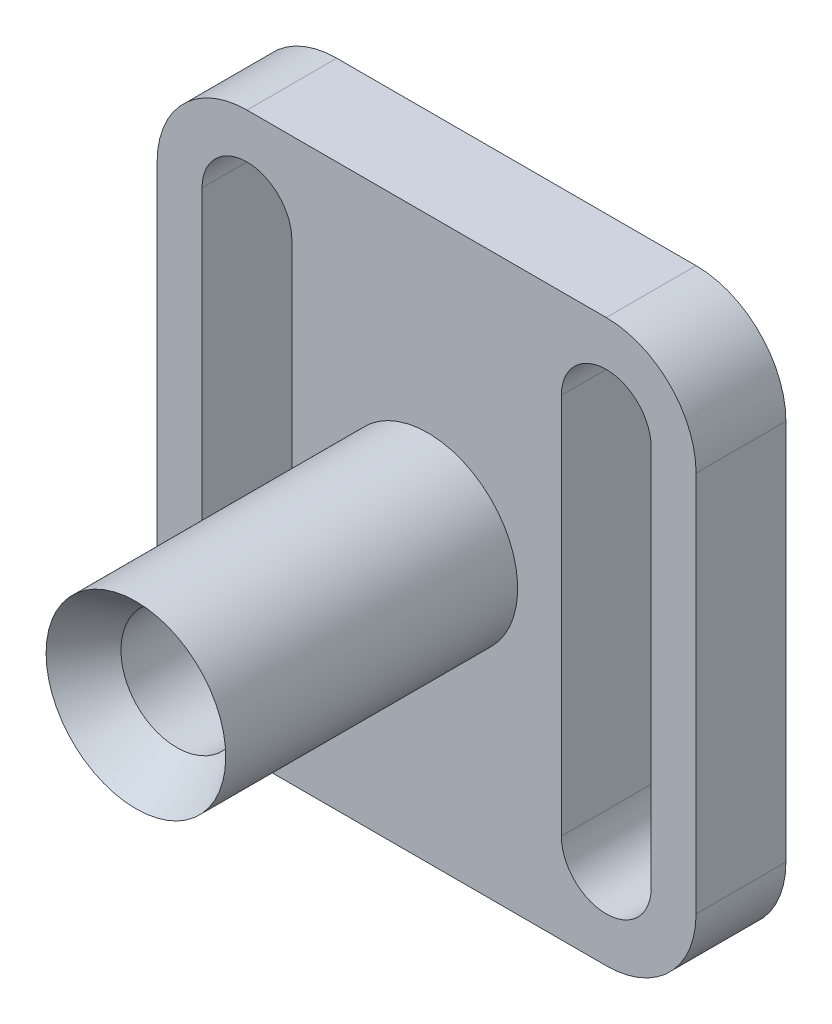
from build123d import *

# Parameters (mm, degrees)
BOSS_EXTRUDE1_DEPTH = 6.35
SKETCH3_R           = 6.35
BOSS_EXTRUDE2_DEPTH = 20.6375
SKETCH5_R           = 4.126342011
CUT_EXTRUDE2_DEPTH  = 62.278322577


with BuildPart() as part:
    # Sketch2 → Boss-Extrude1 (new body)
    with BuildSketch(Plane.XY):
        with BuildLine():
            Line((6.35, 0), (31.75, 0))
            ThreePointArc((31.75, 0), (36.240128061, 1.859871939), (38.1, 6.35))
            Line((38.1, 6.35), (38.1, 33.3375))
            ThreePointArc((38.1, 33.3375), (36.240128061, 37.827628061), (31.75, 39.6875))
            Line((31.75, 39.6875), (6.35, 39.6875))
            ThreePointArc((6.35, 39.6875), (1.859871939, 37.827628061), (0, 33.3375))
            Line((0, 33.3375), (0, 6.35))
            ThreePointArc((0, 6.35), (1.859871939, 1.859871939), (6.35, 0))
        make_face()
        with BuildLine():
            Line((9.525, 33.3375), (9.525, 6.35))
            ThreePointArc((9.525, 6.35), (6.35, 3.175), (3.175, 6.35))
            Line((3.175, 6.35), (3.175, 33.3375))
            ThreePointArc((3.175, 33.3375), (6.35, 36.5125), (9.525, 33.3375))
        make_face(mode=Mode.SUBTRACT)
        with BuildLine():
            Line((34.925, 33.3375), (34.925, 6.35))
            ThreePointArc((34.925, 6.35), (31.75, 3.175), (28.575, 6.35))
            Line((28.575, 6.35), (28.575, 33.3375))
            ThreePointArc((28.575, 33.3375), (31.75, 36.5125), (34.925, 33.3375))
        make_face(mode=Mode.SUBTRACT)
    extrude(amount=BOSS_EXTRUDE1_DEPTH)

    # Sketch3 → Boss-Extrude2 (add)
    with BuildSketch(Plane.XY.offset(6.35)):
        with Locations(Location((19.138936621, 19.975145899, 0), (0, 0, 180))):
            Circle(SKETCH3_R)
    extrude(amount=BOSS_EXTRUDE2_DEPTH)

    # Cut-Loft1: read off the stored shape, not the designer's step
    # Cut-Loft1: loft between two sections, ruled curve by curve
    cut_loft1_from = [
        Edge.make_bspline([(23.27505423, 15.156947986, 26.9875), (13.638658406, 6.884712768, 26.9875), (5.366423187, 16.521108592, 26.9875), (15.002819012, 24.793343811, 26.9875), (24.639214837, 33.065579029, 26.9875), (32.911450055, 23.429183205, 26.9875), (23.27505423, 15.156947986, 26.9875)], [0, 0, 0, 0, 0.5, 0.5, 0.5, 1, 1, 1, 1], 3, [1, 0.333333333, 0.333333333, 1, 0.333333333, 0.333333333, 1]),
    ]
    cut_loft1_to = [
        Edge.make_bspline([(21.665907522, 18.052896418, 22.225), (17.82140856, 12.998954616, 22.225), (12.767466759, 16.843453578, 22.225), (16.611965721, 21.89739538, 22.225), (20.456464682, 26.951337181, 22.225), (25.510406484, 23.106838219, 22.225), (21.665907522, 18.052896418, 22.225)], [0, 0, 0, 0, 0.5, 0.5, 0.5, 1, 1, 1, 1], 3, [1, 0.333333333, 0.333333333, 1, 0.333333333, 0.333333333, 1]),
    ]
    cut_loft1 = Solid(Shell([*[Face.make_surface_from_curves(cut_loft1_from[k], cut_loft1_to[k]) for k in range(1)], Face(Wire(cut_loft1_from)), Face(Wire(cut_loft1_to))]))
    add(cut_loft1, mode=Mode.SUBTRACT)

    # Sketch5 → Cut-Extrude2 (cut, through all)
    with BuildSketch(Plane(origin=(0, 0, 0), x_dir=(-1, 0, 0), z_dir=(0, 0, -1))):
        with Locations((-19.05, 19.84375)):
            Circle(SKETCH5_R)
    extrude(amount=-CUT_EXTRUDE2_DEPTH, mode=Mode.SUBTRACT)


solid = part.part
